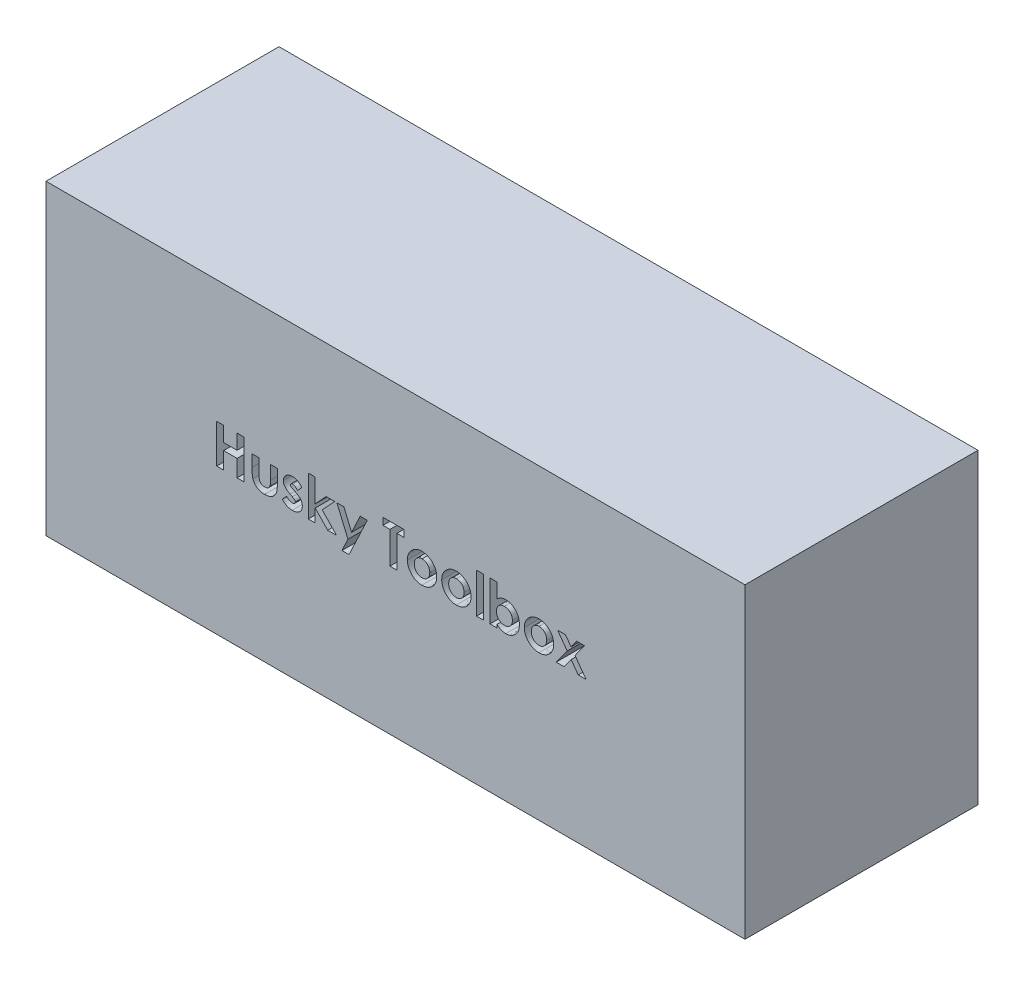
from build123d import *

# Parameters (mm, degrees)
SKETCH1_W           = 1828.8
SKETCH1_H           = 609.6
BOSS_EXTRUDE1_DEPTH = 803.275
SKETCH2_W           = 18.235897436
SKETCH2_H           = 104.205128205
CUT_EXTRUDE1_DEPTH  = 76.2


with BuildPart() as part:
    # Sketch1 → Boss-Extrude1 (new body)
    with BuildSketch(Plane(origin=(0, 0, 0), x_dir=(1, 0, 0), z_dir=(0, 1, 0))):
        Rectangle(SKETCH1_W, SKETCH1_H)
    extrude(amount=BOSS_EXTRUDE1_DEPTH)

    # Sketch2 → Cut-Extrude1 (cut)
    # profile 1 of 12: a face of its own
    with BuildSketch(Plane.XY.offset(304.8)):
        Polygon((-467.882093783, 482.6), (-449.646196347, 482.6), (-449.646196347, 443.523076923), (-414.476965577, 443.523076923), (-414.476965577, 482.6), (-396.241068142, 482.6), (-396.241068142, 381), (-414.476965577, 381), (-414.476965577, 425.287179487), (-449.646196347, 425.287179487), (-449.646196347, 381), (-467.882093783, 381), align=None)
    # profile 2 of 12: a face of its own
    with BuildSketch(Plane.XY.offset(304.8)):
        with BuildLine():
            Line((-375.4000425, 455.246153846), (-357.164145065, 455.246153846))
            Line((-357.164145065, 455.246153846), (-357.164145065, 419.608814103))
            add(Edge.make_bspline(
                [(-357.164145065, 419.608814103), (-357.162525707, 418.774273627), (-357.159417764, 417.172586653), (-357.072933887, 414.87225059), (-356.951579907, 412.768698591), (-356.800138351, 410.85945019), (-356.574102125, 409.149097763), (-356.313152828, 407.640906423), (-356.017320511, 406.324009467), (-355.536259804, 404.856152232), (-354.783631639, 403.249864802), (-353.64702989, 401.544602062), (-352.270273655, 400.070048407), (-350.671963842, 398.813117931), (-348.835777783, 397.822629117), (-346.787013305, 397.151389962), (-344.551448045, 396.700247459), (-342.994380186, 396.654539006), (-342.184657885, 396.630769231)],
                knots=[0, 0, 0, 0, 1.267339619, 2.432334223, 3.495366327, 4.467371443, 5.340232306, 6.114347373, 6.791623365, 7.387877112, 8.457231658, 9.474542289, 10.487879852, 11.508108106, 12.54995813, 13.638205937, 14.771795776, 16, 16, 16, 16], degree=3))
            add(Edge.make_bspline(
                [(-342.184657885, 396.630769231), (-341.375654139, 396.657899066), (-339.814559449, 396.710250174), (-337.564120106, 397.118498038), (-335.51052999, 397.818044352), (-333.632697412, 398.766896366), (-331.985999769, 400.036773171), (-330.552287479, 401.549921474), (-329.34513537, 403.330750214), (-328.765043116, 404.659197429), (-328.46702968, 405.341666667)],
                knots=[0, 0, 0, 0, 1.116871431, 2.155171802, 3.144773418, 4.104381479, 5.046960687, 6.001340237, 6.973219418, 8, 8, 8, 8], degree=3))
            add(Edge.make_bspline(
                [(-328.46702968, 405.341666667), (-328.357668762, 405.644825621), (-328.116267146, 406.314014055), (-327.901414931, 407.468456184), (-327.67016997, 408.82993376), (-327.487246993, 410.426192545), (-327.383742718, 412.247346757), (-327.272848484, 414.295691681), (-327.216334791, 416.569187285), (-327.20900602, 418.163760351), (-327.205170706, 418.998237179)],
                knots=[0, 0, 0, 0, 0.56094539, 1.238222264, 2.041156151, 2.969685991, 4.036367568, 5.220421584, 6.545382566, 8, 8, 8, 8], degree=3))
            Line((-327.205170706, 418.998237179), (-327.205170706, 455.246153846))
            Line((-327.205170706, 455.246153846), (-308.96927327, 455.246153846))
            Line((-308.96927327, 455.246153846), (-308.96927327, 424.045673077))
            add(Edge.make_bspline(
                [(-308.96927327, 424.045673077), (-308.972430797, 422.498687074), (-308.978484734, 419.532646688), (-309.15198684, 415.277958136), (-309.391439408, 411.409597034), (-309.699808249, 407.916912562), (-310.144129648, 404.798455232), (-310.689557842, 402.061537917), (-311.292975556, 399.68807469), (-311.846332096, 398.281781328), (-312.103568142, 397.628044872)],
                knots=[0, 0, 0, 0, 1.388070971, 2.661352173, 3.82033814, 4.865898334, 5.806910977, 6.645039373, 7.370126333, 8, 8, 8, 8], degree=3))
            add(Edge.make_bspline(
                [(-312.103568142, 397.628044872), (-312.433278496, 396.924422468), (-313.084098412, 395.535532291), (-314.213391943, 393.56083805), (-315.430833628, 391.689971702), (-316.794349805, 389.966971599), (-318.276106878, 388.374326219), (-319.834220235, 386.87583086), (-321.538859205, 385.532506509), (-323.345816208, 384.309785646), (-325.280304814, 383.224386644), (-327.32907519, 382.262539284), (-329.51426756, 381.479760465), (-331.816933713, 380.816245009), (-334.24768744, 380.321427404), (-336.801632258, 379.946640821), (-339.481569246, 379.752949687), (-341.309236633, 379.716243691), (-342.245715577, 379.697435897)],
                knots=[0, 0, 0, 0, 0.997311338, 1.968606903, 2.91805772, 3.860812155, 4.785445165, 5.709667791, 6.633356648, 7.568312411, 8.508286151, 9.478643871, 10.470653671, 11.485274776, 12.552984541, 13.653035246, 14.797438149, 16, 16, 16, 16], degree=3))
            add(Edge.make_bspline(
                [(-342.245715577, 379.697435897), (-343.257375993, 379.70949222), (-345.236852369, 379.733082355), (-348.1288397, 380.021969064), (-350.884942508, 380.395750909), (-353.474389074, 381.031248555), (-355.933342226, 381.767504367), (-358.233571792, 382.707162623), (-360.384477085, 383.811934489), (-362.390290303, 385.075270267), (-364.23545509, 386.508747089), (-365.961000745, 388.050401505), (-367.511219242, 389.761571057), (-368.936718905, 391.589414161), (-370.221590355, 393.550753346), (-371.366471323, 395.638614688), (-372.372331584, 397.862494834), (-372.909007929, 399.421117273), (-373.181613013, 400.212820513)],
                knots=[0, 0, 0, 0, 1.211240017, 2.369985978, 3.478996442, 4.539426614, 5.559871561, 6.551301256, 7.510778031, 8.453136967, 9.386094087, 10.30661716, 11.221130616, 12.147659962, 13.080758632, 14.026335491, 14.997475882, 16, 16, 16, 16], degree=3))
            add(Edge.make_bspline(
                [(-373.181613013, 400.212820513), (-373.36759309, 400.827687554), (-373.76823753, 402.152254499), (-374.200810772, 404.353530156), (-374.546798584, 406.890623605), (-374.883364586, 409.766030434), (-375.118159181, 412.984571264), (-375.271623716, 416.541134626), (-375.37531496, 420.442675371), (-375.391557156, 423.156872626), (-375.4000425, 424.574839744)],
                knots=[0, 0, 0, 0, 0.627914866, 1.352675004, 2.190563461, 3.132055958, 4.183353232, 5.345633452, 6.613289997, 8, 8, 8, 8], degree=3))
            Line((-375.4000425, 424.574839744), (-375.4000425, 455.246153846))
        make_face()
    # profile 3 of 12: a face of its own
    with BuildSketch(Plane.XY.offset(304.8)):
        with BuildLine():
            Line((-245.143632244, 443.787660256), (-256.296837372, 431.8))
            add(Edge.make_bspline(
                [(-256.296837372, 431.8), (-256.853770336, 432.416276519), (-257.918972125, 433.594980052), (-259.549693112, 435.201816403), (-261.156129489, 436.539836419), (-262.708345429, 437.663828997), (-264.238042727, 438.525796945), (-265.732506161, 439.145963578), (-267.192452775, 439.539654578), (-268.160167109, 439.590616389), (-268.630491218, 439.615384615)],
                knots=[0, 0, 0, 0, 1.327646587, 2.539285, 3.655602211, 4.666613517, 5.598770349, 6.454635452, 7.248928967, 8, 8, 8, 8], degree=3))
            add(Edge.make_bspline(
                [(-268.630491218, 439.615384615), (-269.106411975, 439.600880181), (-270.017652173, 439.5731087), (-271.303616285, 439.334899061), (-272.433421786, 438.922514268), (-273.389437341, 438.360395366), (-274.157517158, 437.667922611), (-274.695285658, 436.875750115), (-275.05640215, 436.00851631), (-275.086950267, 435.392486633), (-275.102606603, 435.076762821)],
                knots=[0, 0, 0, 0, 1.295068245, 2.479652818, 3.543291146, 4.55379989, 5.481948265, 6.332409746, 7.145336708, 8, 8, 8, 8], degree=3))
            add(Edge.make_bspline(
                [(-275.102606603, 435.076762821), (-275.049561499, 434.598304786), (-274.93949907, 433.605559946), (-274.183522822, 432.454124043), (-273.183311652, 431.604733351), (-272.030357382, 430.814326538), (-270.468958823, 429.93056709), (-269.284442242, 429.325431177), (-268.630491218, 428.991346154)],
                knots=[0, 0, 0, 0, 0.916701701, 1.902049539, 2.5493345, 3.440293453, 4.586830489, 6, 6, 6, 6], degree=3))
            Line((-268.630491218, 428.991346154), (-262.036260449, 425.653525641))
            add(Edge.make_bspline(
                [(-262.036260449, 425.653525641), (-261.197348212, 425.227553258), (-259.569700886, 424.401086817), (-257.281381225, 423.067472235), (-255.167852702, 421.774837207), (-253.271512085, 420.450060905), (-251.580752549, 419.116159118), (-250.107583478, 417.759941323), (-248.816273099, 416.424402184), (-247.376280767, 414.633809319), (-245.935856254, 412.248885313), (-244.734989576, 409.147402778), (-243.969211496, 405.826396923), (-243.884486973, 403.527802134), (-243.841068142, 402.349839744)],
                knots=[0, 0, 0, 0, 1.076693506, 2.088987655, 3.030641824, 3.911722491, 4.735175175, 5.493635918, 6.202154166, 6.859459289, 8.120623445, 9.372284821, 10.653373066, 12, 12, 12, 12], degree=3))
            add(Edge.make_bspline(
                [(-243.841068142, 402.349839744), (-243.867228266, 401.555136226), (-243.918430573, 399.999690543), (-244.242120756, 397.710222788), (-244.823552148, 395.533277934), (-245.58871498, 393.43492175), (-246.619366384, 391.453098916), (-247.870627691, 389.578202241), (-249.322741015, 387.785615357), (-251.014095068, 386.13665914), (-252.866945146, 384.599849995), (-254.926700686, 383.307283145), (-257.102288259, 382.170819803), (-259.451183442, 381.283343121), (-261.940428313, 380.563835327), (-264.591360841, 380.065234453), (-267.394985863, 379.751452147), (-269.314823558, 379.715747053), (-270.299401475, 379.697435897)],
                knots=[0, 0, 0, 0, 0.976600749, 1.911466839, 2.833459288, 3.740827163, 4.650527853, 5.570709661, 6.506801416, 7.479409329, 8.468875524, 9.458587492, 10.461481786, 11.480119772, 12.538142914, 13.641687514, 14.790552763, 16, 16, 16, 16], degree=3))
            add(Edge.make_bspline(
                [(-270.299401475, 379.697435897), (-271.603882656, 379.738976375), (-274.164464364, 379.820516675), (-277.904008573, 380.388514764), (-281.435131077, 381.371729021), (-284.760737027, 382.749086426), (-287.901195281, 384.504217347), (-290.811656578, 386.681950612), (-293.542576417, 389.225547087), (-295.131453952, 391.176367126), (-295.943632244, 392.173557692)],
                knots=[0, 0, 0, 0, 1.056901255, 2.07460411, 3.05625841, 4.019970729, 4.984811261, 5.963335951, 6.958928997, 8, 8, 8, 8], degree=3))
            Line((-295.943632244, 392.173557692), (-284.892189936, 404.446153846))
            add(Edge.make_bspline(
                [(-284.892189936, 404.446153846), (-284.353726347, 403.878213229), (-283.284700015, 402.750665357), (-281.482753611, 401.263841039), (-279.576166696, 399.908710061), (-277.5437144, 398.770842188), (-275.510851422, 397.852065081), (-273.560487115, 397.162853726), (-271.729378261, 396.729730923), (-270.538838488, 396.66262188), (-269.973760449, 396.630769231)],
                knots=[0, 0, 0, 0, 1.087861918, 2.159761696, 3.243809206, 4.338405912, 5.394481878, 6.343674753, 7.213841449, 8, 8, 8, 8], degree=3))
            add(Edge.make_bspline(
                [(-269.973760449, 396.630769231), (-269.40898828, 396.647125411), (-268.323340299, 396.678566503), (-266.780353407, 397.00561557), (-265.412733021, 397.555433368), (-264.252940016, 398.317769693), (-263.288255228, 399.192815372), (-262.608529452, 400.187309916), (-262.159058782, 401.241852654), (-262.104430886, 401.979148801), (-262.076965577, 402.349839744)],
                knots=[0, 0, 0, 0, 1.255011871, 2.412479185, 3.488767498, 4.514443302, 5.48617286, 6.365347346, 7.178144445, 8, 8, 8, 8], degree=3))
            add(Edge.make_bspline(
                [(-262.076965577, 402.349839744), (-262.101472778, 402.698923307), (-262.151790785, 403.415659155), (-262.550160059, 404.47361255), (-263.175607662, 405.521156162), (-264.043069359, 406.561243496), (-265.164087837, 407.585435475), (-266.53465125, 408.585528661), (-268.123140659, 409.614879252), (-269.296489352, 410.229263714), (-269.912702757, 410.551923077)],
                knots=[0, 0, 0, 0, 0.704666567, 1.446816302, 2.258757648, 3.165368109, 4.175243826, 5.322435858, 6.59381024, 8, 8, 8, 8], degree=3))
            Line((-269.912702757, 410.551923077), (-275.957414295, 413.604807692))
            add(Edge.make_bspline(
                [(-275.957414295, 413.604807692), (-277.328596176, 414.340090271), (-279.960751283, 415.751557138), (-283.518441033, 418.171922857), (-286.529511798, 420.748450339), (-288.996417356, 423.467297589), (-290.962052588, 426.320834874), (-292.333215041, 429.345393303), (-293.195801466, 432.512299382), (-293.290699776, 434.677864116), (-293.338504039, 435.76875)],
                knots=[0, 0, 0, 0, 1.255999728, 2.41104856, 3.467751088, 4.449286722, 5.368722015, 6.253902015, 7.120417131, 8, 8, 8, 8], degree=3))
            add(Edge.make_bspline(
                [(-293.338504039, 435.76875), (-293.321925919, 436.475759698), (-293.289380376, 437.863734605), (-292.942913518, 439.902071943), (-292.419476444, 441.861432308), (-291.680850346, 443.744927337), (-290.734683212, 445.554425956), (-289.575464323, 447.281897766), (-288.189051315, 448.924202203), (-286.619829108, 450.476049044), (-284.878727813, 451.889382777), (-283.015493357, 453.141926959), (-281.035636838, 454.208861693), (-278.922909841, 455.059497958), (-276.704166261, 455.736551484), (-274.364760039, 456.196764176), (-271.914672148, 456.489461057), (-270.239202779, 456.528685779), (-269.38353609, 456.548717949)],
                knots=[0, 0, 0, 0, 0.959035663, 1.882742823, 2.798841253, 3.708806893, 4.623422363, 5.566085165, 6.527241613, 7.536786942, 8.55815439, 9.567237405, 10.580975912, 11.605536372, 12.654523293, 13.725718749, 14.838518481, 16, 16, 16, 16], degree=3))
            add(Edge.make_bspline(
                [(-269.38353609, 456.548717949), (-268.200571367, 456.50976987), (-265.852595058, 456.432464805), (-262.389791794, 455.806911748), (-259.045083027, 454.755501446), (-255.827845541, 453.306833878), (-252.779463052, 451.486270451), (-249.966970971, 449.275491579), (-247.371335322, 446.72893666), (-245.893573786, 444.77782155), (-245.143632244, 443.787660256)],
                knots=[0, 0, 0, 0, 0.996590028, 1.978055413, 2.954661574, 3.945146934, 4.945404762, 5.939399542, 6.954276554, 8, 8, 8, 8], degree=3))
        make_face()
    # profile 4 of 12: a face of its own
    with BuildSketch(Plane.XY.offset(304.8)):
        Polygon((-228.210298911, 485.205128205), (-209.974401475, 485.205128205), (-209.974401475, 424.432371795), (-181.602927116, 455.246153846), (-159.072638654, 455.246153846), (-191.657093783, 419.853044872), (-154.411901475, 381), (-177.369593783, 381), (-209.974401475, 415.009134615), (-209.974401475, 381), (-228.210298911, 381), align=None)
    # profile 5 of 12: a face of its own
    with BuildSketch(Plane.XY.offset(304.8)):
        Polygon((-153.353568142, 455.246153846), (-135.097318142, 455.246153846), (-114.826164295, 407.478685897), (-92.397638654, 455.246153846), (-73.856452757, 455.246153846), (-121.583215577, 353.646153846), (-140.124401475, 353.646153846), (-124.432574552, 387.044711538), align=None)
    # profile 6 of 12: a face of its own
    with BuildSketch(Plane.XY.offset(304.8)):
        Polygon((-32.825683526, 482.6), (21.882008782, 482.6), (21.882008782, 464.364102564), (3.646111346, 464.364102564), (3.646111346, 381), (-14.58978609, 381), (-14.58978609, 464.364102564), (-32.825683526, 464.364102564), align=None)
    # profile 7 of 12: a face of its own
    with BuildSketch(Plane.XY.offset(304.8)):
        with BuildLine():
            add(Edge.make_bspline(
                [(68.977842115, 456.548717949), (69.840000141, 456.533375257), (71.547463696, 456.502989774), (74.090517354, 456.250058382), (76.589112574, 455.837390386), (79.057610941, 455.303057365), (81.473090149, 454.554376883), (83.848219087, 453.656450411), (86.204234427, 452.625525813), (88.48266034, 451.398364947), (90.69995675, 450.067397071), (92.802085706, 448.599230298), (94.771590478, 447.005396577), (96.645031775, 445.3228502), (98.335104212, 443.478338586), (99.949812485, 441.560738038), (101.401917838, 439.501347624), (102.746358221, 437.350349924), (103.943303824, 435.120183735), (104.982630949, 432.82636289), (105.884669177, 430.500601083), (106.590947033, 428.114568946), (107.175679998, 425.699729478), (107.544688059, 423.226490632), (107.807027205, 420.720258779), (107.836443738, 419.032857257), (107.851239551, 418.184134615)],
                knots=[0, 0, 0, 0, 1.022364134, 2.024744242, 3.027414945, 4.024939316, 5.017584196, 6.023349371, 7.035562955, 8.064994934, 9.090267829, 10.101425541, 11.102933353, 12.093946398, 13.084502048, 14.067315274, 15.065326281, 16.070028806, 17.074376865, 18.064572984, 19.055292013, 20.030201733, 21.013838017, 21.999348303, 22.993720005, 24, 24, 24, 24], degree=3))
            add(Edge.make_bspline(
                [(107.851239551, 418.184134615), (107.835625021, 417.328781327), (107.804579797, 415.628145087), (107.554179165, 413.098339026), (107.13993161, 410.61346969), (106.603547795, 408.158898289), (105.857669087, 405.766033403), (104.98618943, 403.39960327), (103.916413869, 401.091863213), (102.73369816, 398.817637962), (101.380613592, 396.643851025), (99.9297652, 394.563830488), (98.321820121, 392.632145062), (96.645277183, 390.788887806), (94.82061416, 389.096389433), (92.876956084, 387.527168278), (90.831129636, 386.062039917), (88.668423164, 384.735379018), (86.416537323, 383.569689396), (84.113449752, 382.518725075), (81.745693275, 381.643722235), (79.318168085, 380.930181514), (76.829401978, 380.377704796), (74.284889503, 380.002400789), (71.690110595, 379.741381179), (69.941850741, 379.712178628), (69.059252371, 379.697435897)],
                knots=[0, 0, 0, 0, 1.012026251, 2.012137606, 3.004615893, 3.992048833, 4.982446996, 5.968083444, 6.973977695, 7.990229942, 8.999482246, 10.001782172, 10.988562221, 11.971415814, 12.948383116, 13.930088534, 14.925840678, 15.924049238, 16.929462851, 17.924729459, 18.917889337, 19.913673841, 20.916777188, 21.931792057, 22.95587778, 24, 24, 24, 24], degree=3))
            add(Edge.make_bspline(
                [(69.059252371, 379.697435897), (67.768713581, 379.735315756), (65.225041976, 379.809977533), (61.478815086, 380.321391176), (57.879927697, 381.201668138), (54.422515465, 382.428754813), (51.102087124, 384.001220663), (47.94762072, 385.947385939), (44.927737906, 388.228936226), (42.094745334, 390.826587663), (39.499340354, 393.676446514), (37.231941841, 396.718653475), (35.306737014, 399.907610972), (33.725457977, 403.246955497), (32.505033013, 406.741266188), (31.623677958, 410.380096281), (31.111639055, 414.173673997), (31.037608739, 416.751140129), (30.9999575, 418.062019231)],
                knots=[0, 0, 0, 0, 1.029999031, 2.030143771, 3.011211297, 3.982305373, 4.953580601, 5.938004764, 6.935448627, 7.970290061, 9.001484052, 10.007591832, 10.993831261, 11.969999897, 12.951306496, 13.942897864, 14.953773953, 16, 16, 16, 16], degree=3))
            add(Edge.make_bspline(
                [(30.9999575, 418.062019231), (31.03892175, 419.461750752), (31.115505205, 422.212895032), (31.723611537, 426.243384096), (32.694691747, 430.102386361), (34.088616221, 433.779106977), (35.869232138, 437.280327155), (38.04296063, 440.598662438), (40.620544399, 443.734864464), (42.594457423, 445.631746965), (43.598194679, 446.596314103)],
                knots=[0, 0, 0, 0, 1.043912699, 2.05178951, 3.033892, 4.007821512, 4.978932272, 5.95884105, 6.962068106, 8, 8, 8, 8], degree=3))
            add(Edge.make_bspline(
                [(43.598194679, 446.596314103), (44.519223944, 447.395831764), (46.336224017, 448.9731146), (49.288251119, 450.973639295), (52.310793761, 452.701482303), (55.440078416, 454.122090618), (58.684828725, 455.19320637), (62.028417183, 455.972882802), (65.470148537, 456.451782915), (67.80266903, 456.516242067), (68.977842115, 456.548717949)],
                knots=[0, 0, 0, 0, 1.048115528, 2.067714963, 3.060638214, 4.039924844, 5.017819947, 5.994373833, 6.98952318, 8, 8, 8, 8], degree=3))
        make_face()
        with BuildLine():
            add(Edge.make_bspline(
                [(69.384893397, 439.615384615), (68.678849491, 439.591918054), (67.288994463, 439.545723877), (65.243091346, 439.297812062), (63.308054632, 438.789695509), (61.445450887, 438.143510317), (59.688229752, 437.279328666), (57.988267202, 436.268036986), (56.433957546, 435.002529892), (54.950082774, 433.614361192), (53.603055236, 432.072837104), (52.455259862, 430.393347765), (51.429679269, 428.640146915), (50.652033512, 426.749047687), (50.008457309, 424.771739312), (49.572892651, 422.676274499), (49.269770064, 420.486060735), (49.247267507, 418.985749292), (49.235854935, 418.224839744)],
                knots=[0, 0, 0, 0, 1.030650113, 2.02884584, 2.99876339, 3.944280128, 4.900564847, 5.851248946, 6.823638398, 7.81794922, 8.81432732, 9.802856497, 10.78262424, 11.771747962, 12.779760563, 13.812642396, 14.89064281, 16, 16, 16, 16], degree=3))
            add(Edge.make_bspline(
                [(49.235854935, 418.224839744), (49.249209195, 417.437096695), (49.275307531, 415.897604184), (49.545561268, 413.649738096), (49.991218586, 411.516528077), (50.624357969, 409.501269478), (51.420637648, 407.589497019), (52.397580475, 405.791937037), (53.565496987, 404.119397562), (54.889630843, 402.573938209), (56.33950086, 401.17110765), (57.928155079, 399.967250956), (59.58906664, 398.921259268), (61.360511957, 398.081166498), (63.217331436, 397.432546721), (65.165037205, 396.954989795), (67.213864456, 396.697705274), (68.61084085, 396.653388048), (69.323835705, 396.630769231)],
                knots=[0, 0, 0, 0, 1.141730614, 2.231293227, 3.276944405, 4.297399982, 5.28939179, 6.275415646, 7.257752684, 8.24146775, 9.222424823, 10.176631434, 11.126518621, 12.063689483, 13.012557477, 13.974037417, 14.965980454, 16, 16, 16, 16], degree=3))
            add(Edge.make_bspline(
                [(69.323835705, 396.630769231), (70.037187163, 396.6508311), (71.435770134, 396.690164011), (73.487003349, 396.984705395), (75.444655534, 397.448255479), (77.317333704, 398.102457704), (79.089897081, 398.960532209), (80.769131195, 400.01152806), (82.36980848, 401.232129318), (83.839135895, 402.661428624), (85.199264181, 404.211707711), (86.392015338, 405.893076403), (87.388723187, 407.690636847), (88.206202096, 409.593078771), (88.840582649, 411.59778729), (89.278862023, 413.71221365), (89.582146674, 415.929805087), (89.604140313, 417.450380281), (89.615342115, 418.224839744)],
                knots=[0, 0, 0, 0, 1.031504075, 2.022346795, 2.991027682, 3.937587355, 4.885570121, 5.833146507, 6.798790848, 7.791235734, 8.792807298, 9.778388351, 10.766749885, 11.760164525, 12.768777521, 13.802286646, 14.880660483, 16, 16, 16, 16], degree=3))
            add(Edge.make_bspline(
                [(89.615342115, 418.224839744), (89.601817972, 418.999028529), (89.575279218, 420.518238071), (89.305006223, 422.738828767), (88.86372246, 424.84642071), (88.222416974, 426.832014655), (87.430870269, 428.718263084), (86.453252185, 430.495510994), (85.279575879, 432.155004985), (83.949005037, 433.688516366), (82.477400562, 435.071662023), (80.916329213, 436.305092181), (79.230094087, 437.325233682), (77.45032997, 438.166194442), (75.572301757, 438.813193701), (73.598117847, 439.29345707), (71.521727977, 439.547080541), (70.104615755, 439.592378637), (69.384893397, 439.615384615)],
                knots=[0, 0, 0, 0, 1.123894411, 2.205445421, 3.243160173, 4.246488011, 5.231014757, 6.210004299, 7.185865357, 8.177612767, 9.153374344, 10.115157457, 11.061423229, 12.009021698, 12.96873347, 13.94135618, 14.954456845, 16, 16, 16, 16], degree=3))
        make_face(mode=Mode.SUBTRACT)
    # profile 8 of 12: a face of its own
    with BuildSketch(Plane.XY.offset(304.8)):
        with BuildLine():
            add(Edge.make_bspline(
                [(158.854765192, 456.548717949), (159.716923218, 456.533375257), (161.424386772, 456.502989774), (163.967440431, 456.250058382), (166.466035651, 455.837390386), (168.934534018, 455.303057365), (171.350013226, 454.554376883), (173.725142164, 453.656450411), (176.081157504, 452.625525813), (178.359583417, 451.398364947), (180.576879827, 450.067397071), (182.679008783, 448.599230298), (184.648513555, 447.005396577), (186.521954852, 445.3228502), (188.212027289, 443.478338586), (189.826735562, 441.560738038), (191.278840915, 439.501347624), (192.623281298, 437.350349924), (193.820226901, 435.120183735), (194.859554026, 432.82636289), (195.761592253, 430.500601083), (196.467870109, 428.114568946), (197.052603075, 425.699729478), (197.421611136, 423.226490632), (197.683950282, 420.720258779), (197.713366815, 419.032857257), (197.728162628, 418.184134615)],
                knots=[0, 0, 0, 0, 1.022364134, 2.024744242, 3.027414945, 4.024939316, 5.017584196, 6.023349371, 7.035562955, 8.064994934, 9.090267829, 10.101425541, 11.102933353, 12.093946398, 13.084502048, 14.067315274, 15.065326281, 16.070028806, 17.074376865, 18.064572984, 19.055292013, 20.030201733, 21.013838017, 21.999348303, 22.993720005, 24, 24, 24, 24], degree=3))
            add(Edge.make_bspline(
                [(197.728162628, 418.184134615), (197.712548098, 417.328781327), (197.681502874, 415.628145087), (197.431102242, 413.098339026), (197.016854687, 410.61346969), (196.480470872, 408.158898289), (195.734592164, 405.766033403), (194.863112507, 403.39960327), (193.793336946, 401.091863213), (192.610621237, 398.817637962), (191.257536669, 396.643851025), (189.806688277, 394.563830488), (188.198743198, 392.632145062), (186.52220026, 390.788887806), (184.697537237, 389.096389433), (182.753879161, 387.527168278), (180.708052713, 386.062039917), (178.545346241, 384.735379018), (176.293460399, 383.569689396), (173.990372829, 382.518725075), (171.622616352, 381.643722235), (169.195091162, 380.930181514), (166.706325055, 380.377704796), (164.16181258, 380.002400789), (161.567033672, 379.741381179), (159.818773818, 379.712178628), (158.936175448, 379.697435897)],
                knots=[0, 0, 0, 0, 1.012026251, 2.012137606, 3.004615893, 3.992048833, 4.982446996, 5.968083444, 6.973977695, 7.990229942, 8.999482246, 10.001782172, 10.988562221, 11.971415814, 12.948383116, 13.930088534, 14.925840678, 15.924049238, 16.929462851, 17.924729459, 18.917889337, 19.913673841, 20.916777188, 21.931792057, 22.95587778, 24, 24, 24, 24], degree=3))
            add(Edge.make_bspline(
                [(158.936175448, 379.697435897), (157.645636658, 379.735315756), (155.101965053, 379.809977533), (151.355738163, 380.321391176), (147.756850774, 381.201668138), (144.299438542, 382.428754813), (140.979010201, 384.001220663), (137.824543797, 385.947385939), (134.804660983, 388.228936226), (131.971668411, 390.826587663), (129.376263431, 393.676446514), (127.108864918, 396.718653475), (125.183660091, 399.907610972), (123.602381054, 403.246955497), (122.38195609, 406.741266188), (121.500601035, 410.380096281), (120.988562132, 414.173673997), (120.914531816, 416.751140129), (120.876880576, 418.062019231)],
                knots=[0, 0, 0, 0, 1.029999031, 2.030143771, 3.011211297, 3.982305373, 4.953580601, 5.938004764, 6.935448627, 7.970290061, 9.001484052, 10.007591832, 10.993831261, 11.969999897, 12.951306496, 13.942897864, 14.953773953, 16, 16, 16, 16], degree=3))
            add(Edge.make_bspline(
                [(120.876880576, 418.062019231), (120.915844827, 419.461750752), (120.992428282, 422.212895032), (121.600534614, 426.243384096), (122.571614823, 430.102386361), (123.965539298, 433.779106977), (125.746155215, 437.280327155), (127.919883707, 440.598662438), (130.497467476, 443.734864464), (132.4713805, 445.631746965), (133.475117756, 446.596314103)],
                knots=[0, 0, 0, 0, 1.043912699, 2.05178951, 3.033892, 4.007821512, 4.978932272, 5.95884105, 6.962068106, 8, 8, 8, 8], degree=3))
            add(Edge.make_bspline(
                [(133.475117756, 446.596314103), (134.39614702, 447.395831764), (136.213147094, 448.9731146), (139.165174196, 450.973639295), (142.187716837, 452.701482303), (145.317001493, 454.122090618), (148.561751802, 455.19320637), (151.90534026, 455.972882802), (155.347071614, 456.451782915), (157.679592107, 456.516242067), (158.854765192, 456.548717949)],
                knots=[0, 0, 0, 0, 1.048115528, 2.067714963, 3.060638214, 4.039924844, 5.017819947, 5.994373833, 6.98952318, 8, 8, 8, 8], degree=3))
        make_face()
        with BuildLine():
            add(Edge.make_bspline(
                [(159.261816474, 439.615384615), (158.555772568, 439.591918054), (157.16591754, 439.545723877), (155.120014423, 439.297812062), (153.184977709, 438.789695509), (151.322373964, 438.143510317), (149.565152829, 437.279328666), (147.865190278, 436.268036986), (146.310880623, 435.002529892), (144.827005851, 433.614361192), (143.479978313, 432.072837104), (142.332182938, 430.393347765), (141.306602346, 428.640146915), (140.528956589, 426.749047687), (139.885380385, 424.771739312), (139.449815728, 422.676274499), (139.146693141, 420.486060735), (139.124190583, 418.985749292), (139.112778012, 418.224839744)],
                knots=[0, 0, 0, 0, 1.030650113, 2.02884584, 2.99876339, 3.944280128, 4.900564847, 5.851248946, 6.823638398, 7.81794922, 8.81432732, 9.802856497, 10.78262424, 11.771747962, 12.779760563, 13.812642396, 14.89064281, 16, 16, 16, 16], degree=3))
            add(Edge.make_bspline(
                [(139.112778012, 418.224839744), (139.126132272, 417.437096695), (139.152230608, 415.897604184), (139.422484345, 413.649738096), (139.868141663, 411.516528077), (140.501281046, 409.501269478), (141.297560725, 407.589497019), (142.274503552, 405.791937037), (143.442420064, 404.119397562), (144.76655392, 402.573938209), (146.216423937, 401.17110765), (147.805078156, 399.967250956), (149.465989717, 398.921259268), (151.237435034, 398.081166498), (153.094254513, 397.432546721), (155.041960282, 396.954989795), (157.090787533, 396.697705274), (158.487763927, 396.653388048), (159.200758782, 396.630769231)],
                knots=[0, 0, 0, 0, 1.141730614, 2.231293227, 3.276944405, 4.297399982, 5.28939179, 6.275415646, 7.257752684, 8.24146775, 9.222424823, 10.176631434, 11.126518621, 12.063689483, 13.012557477, 13.974037417, 14.965980454, 16, 16, 16, 16], degree=3))
            add(Edge.make_bspline(
                [(159.200758782, 396.630769231), (159.91411024, 396.6508311), (161.312693211, 396.690164011), (163.363926426, 396.984705395), (165.321578611, 397.448255479), (167.19425678, 398.102457704), (168.966820157, 398.960532209), (170.646054272, 400.01152806), (172.246731557, 401.232129318), (173.716058972, 402.661428624), (175.076187258, 404.211707711), (176.268938415, 405.893076403), (177.265646264, 407.690636847), (178.083125173, 409.593078771), (178.717505726, 411.59778729), (179.1557851, 413.71221365), (179.459069751, 415.929805087), (179.48106339, 417.450380281), (179.492265192, 418.224839744)],
                knots=[0, 0, 0, 0, 1.031504075, 2.022346795, 2.991027682, 3.937587355, 4.885570121, 5.833146507, 6.798790848, 7.791235734, 8.792807298, 9.778388351, 10.766749885, 11.760164525, 12.768777521, 13.802286646, 14.880660483, 16, 16, 16, 16], degree=3))
            add(Edge.make_bspline(
                [(179.492265192, 418.224839744), (179.478741049, 418.999028529), (179.452202295, 420.518238071), (179.1819293, 422.738828767), (178.740645537, 424.84642071), (178.099340051, 426.832014655), (177.307793346, 428.718263084), (176.330175262, 430.495510994), (175.156498956, 432.155004985), (173.825928114, 433.688516366), (172.354323639, 435.071662023), (170.79325229, 436.305092181), (169.107017164, 437.325233682), (167.327253047, 438.166194442), (165.449224834, 438.813193701), (163.475040924, 439.29345707), (161.398651054, 439.547080541), (159.981538832, 439.592378637), (159.261816474, 439.615384615)],
                knots=[0, 0, 0, 0, 1.123894411, 2.205445421, 3.243160173, 4.246488011, 5.231014757, 6.210004299, 7.185865357, 8.177612767, 9.153374344, 10.115157457, 11.061423229, 12.009021698, 12.96873347, 13.94135618, 14.954456845, 16, 16, 16, 16], degree=3))
        make_face(mode=Mode.SUBTRACT)
    # profile 9 of 12: a face of its own
    with BuildSketch(Plane.XY.offset(304.8)):
        with Locations((221.174316474, 433.102564103)):
            Rectangle(SKETCH2_W, SKETCH2_H)
    # profile 10 of 12: a face of its own
    with BuildSketch(Plane.XY.offset(304.8)):
        with BuildLine():
            Line((265.461495961, 485.205128205), (265.461495961, 446.596314103))
            add(Edge.make_bspline(
                [(265.461495961, 446.596314103), (266.308287636, 447.393619503), (267.970584783, 448.958772457), (270.684649457, 450.982686535), (273.49609719, 452.69085343), (276.402409352, 454.123925542), (279.429743014, 455.183620577), (282.5409019, 456.00704332), (285.767765173, 456.443145363), (287.949956439, 456.513332696), (289.050117756, 456.548717949)],
                knots=[0, 0, 0, 0, 1.061187343, 2.083167259, 3.083809127, 4.061667593, 5.035358583, 6.007314429, 6.995378812, 8, 8, 8, 8], degree=3))
            add(Edge.make_bspline(
                [(289.050117756, 456.548717949), (290.246008021, 456.520073362), (292.601523804, 456.46365282), (296.06721709, 455.936886015), (299.38845833, 455.08540372), (302.577912278, 453.896502365), (305.618585884, 452.352912515), (308.544643288, 450.504755117), (311.305621184, 448.275765059), (313.902861775, 445.751060077), (316.305374021, 442.983795872), (318.395117222, 439.975192363), (320.135792208, 436.764848551), (321.611099784, 433.390717398), (322.687838513, 429.796840068), (323.517698883, 426.031426015), (323.980143652, 422.062619028), (324.044216965, 419.358916074), (324.076880576, 417.980608974)],
                knots=[0, 0, 0, 0, 0.985987466, 1.942075377, 2.884088208, 3.810275091, 4.743821533, 5.692411115, 6.659945104, 7.665215984, 8.677116751, 9.678438675, 10.680260931, 11.685531812, 12.710472044, 13.769734641, 14.863044265, 16, 16, 16, 16], degree=3))
            add(Edge.make_bspline(
                [(324.076880576, 417.980608974), (324.045966645, 416.649484999), (323.985028469, 414.025546149), (323.492686434, 410.173388), (322.65820791, 406.49348495), (321.487603657, 402.984511715), (319.999450274, 399.63537933), (318.183056351, 396.448395538), (316.027826478, 393.434692393), (313.563842559, 390.634867528), (310.871582064, 388.099417976), (308.066439603, 385.824615631), (305.092545967, 383.960593498), (302.024241848, 382.386284), (298.813189824, 381.182439994), (295.481322794, 380.339011961), (292.033917623, 379.775127997), (289.690101998, 379.723591198), (288.500598525, 379.697435897)],
                knots=[0, 0, 0, 0, 1.098553145, 2.165490463, 3.199345634, 4.208780719, 5.21409072, 6.219899742, 7.23156933, 8.267303578, 9.293302409, 10.281606823, 11.243293419, 12.184993323, 13.124258899, 14.066907486, 15.018941492, 16, 16, 16, 16], degree=3))
            add(Edge.make_bspline(
                [(288.500598525, 379.697435897), (287.441018429, 379.725761272), (285.354628183, 379.781535992), (282.279202126, 380.195204228), (279.323829347, 380.890914495), (276.451176455, 381.849259879), (273.653449012, 383.158641437), (270.881924539, 384.795851788), (268.118766099, 386.781605413), (266.365082693, 388.311857131), (265.461495961, 389.100320513)],
                knots=[0, 0, 0, 0, 0.996418773, 1.962021009, 2.912343664, 3.848616743, 4.805003894, 5.811808768, 6.872532775, 8, 8, 8, 8], degree=3))
            Line((265.461495961, 389.100320513), (265.461495961, 381))
            Line((265.461495961, 381), (247.225598525, 381))
            Line((247.225598525, 381), (247.225598525, 485.205128205))
            Line((247.225598525, 485.205128205), (265.461495961, 485.205128205))
        make_face()
        with BuildLine():
            add(Edge.make_bspline(
                [(285.10172032, 439.615384615), (284.361653199, 439.592627043), (282.910719326, 439.548009828), (280.780484138, 439.29230877), (278.762048789, 438.811205364), (276.82472461, 438.187646085), (274.993043694, 437.345939001), (273.252020813, 436.325616987), (271.616568002, 435.108960875), (270.078197292, 433.744148741), (268.695848904, 432.208732524), (267.467752276, 430.568060661), (266.44888253, 428.80076851), (265.59954355, 426.929265132), (264.958754397, 424.933301045), (264.483474493, 422.829855956), (264.225189992, 420.612483736), (264.181367218, 419.100614188), (264.158931858, 418.326602564)],
                knots=[0, 0, 0, 0, 1.060469436, 2.079096586, 3.066888298, 4.028858836, 4.99004353, 5.948472697, 6.914558426, 7.905691313, 8.889602648, 9.869280844, 10.836099585, 11.806137001, 12.808075328, 13.83377171, 14.890985086, 16, 16, 16, 16], degree=3))
            add(Edge.make_bspline(
                [(264.158931858, 418.326602564), (264.181649522, 417.539045104), (264.226233915, 415.99342968), (264.482365283, 413.728774969), (264.954309205, 411.583188157), (265.608594584, 409.55180465), (266.44348092, 407.634360888), (267.461143499, 405.82374863), (268.702758292, 404.159664613), (270.06992107, 402.583766096), (271.617803908, 401.200692484), (273.245888968, 399.960265711), (274.992620715, 398.938422789), (276.833055299, 398.110488488), (278.753227663, 397.422479617), (280.781752037, 396.957592734), (282.91038289, 396.697149582), (284.361539559, 396.653190907), (285.10172032, 396.630769231)],
                knots=[0, 0, 0, 0, 1.117193555, 2.192540452, 3.22680955, 4.227918444, 5.21468246, 6.188555072, 7.166222992, 8.154674427, 9.142376254, 10.104580718, 11.053462639, 12.005072638, 12.963662044, 13.941614018, 14.950094269, 16, 16, 16, 16], degree=3))
            add(Edge.make_bspline(
                [(285.10172032, 396.630769231), (285.814977235, 396.651598284), (287.226816783, 396.692827862), (289.292577226, 396.98051337), (291.278287664, 397.450620089), (293.168397365, 398.120692222), (294.974412167, 398.993125456), (296.712773504, 400.014016741), (298.32346661, 401.289544183), (299.869681661, 402.691457735), (301.253131046, 404.272413023), (302.494251408, 405.951969792), (303.536829395, 407.745118426), (304.364611746, 409.657805272), (305.048963015, 411.653801262), (305.516191217, 413.769640023), (305.773251611, 415.986436185), (305.818181661, 417.498294381), (305.840983141, 418.265544872)],
                knots=[0, 0, 0, 0, 1.021711385, 2.02240246, 2.981887075, 3.941027022, 4.888772411, 5.852236371, 6.822344989, 7.82661704, 8.838806642, 9.826383926, 10.814965113, 11.80282933, 12.807900643, 13.833672313, 14.900613836, 16, 16, 16, 16], degree=3))
            add(Edge.make_bspline(
                [(305.840983141, 418.265544872), (305.817817532, 419.025892693), (305.772174796, 420.523990781), (305.520378453, 422.722326965), (305.035161257, 424.807405071), (304.422512782, 426.79625867), (303.566587948, 428.662998059), (302.554543131, 430.429706476), (301.3636849, 432.10171837), (299.982238045, 433.633897593), (298.467034328, 435.028070615), (296.849580163, 436.261228152), (295.136227447, 437.310996569), (293.30364406, 438.13885787), (291.395076086, 438.820009309), (289.381356627, 439.289195422), (287.272723232, 439.548869266), (285.835107448, 439.592915046), (285.10172032, 439.615384615)],
                knots=[0, 0, 0, 0, 1.094680664, 2.156827393, 3.177782763, 4.17210342, 5.146667393, 6.126451192, 7.099203661, 8.094961544, 9.09004898, 10.058676268, 11.018205477, 11.974998356, 12.947750825, 13.930643515, 14.944335875, 16, 16, 16, 16], degree=3))
        make_face(mode=Mode.SUBTRACT)
    # profile 11 of 12: a face of its own
    with BuildSketch(Plane.XY.offset(304.8)):
        with BuildLine():
            add(Edge.make_bspline(
                [(375.080406217, 456.548717949), (375.942564244, 456.533375257), (377.650027798, 456.502989774), (380.193081457, 456.250058382), (382.691676677, 455.837390386), (385.160175044, 455.303057365), (387.575654251, 454.554376883), (389.950783189, 453.656450411), (392.30679853, 452.625525813), (394.585224443, 451.398364947), (396.802520853, 450.067397071), (398.904649809, 448.599230298), (400.87415458, 447.005396577), (402.747595878, 445.3228502), (404.437668314, 443.478338586), (406.052376587, 441.560738038), (407.504481941, 439.501347624), (408.848922324, 437.350349924), (410.045867926, 435.120183735), (411.085195051, 432.82636289), (411.987233279, 430.500601083), (412.693511135, 428.114568946), (413.278244101, 425.699729478), (413.647252162, 423.226490632), (413.909591307, 420.720258779), (413.93900784, 419.032857257), (413.953803653, 418.184134615)],
                knots=[0, 0, 0, 0, 1.022364134, 2.024744242, 3.027414945, 4.024939316, 5.017584196, 6.023349371, 7.035562955, 8.064994934, 9.090267829, 10.101425541, 11.102933353, 12.093946398, 13.084502048, 14.067315274, 15.065326281, 16.070028806, 17.074376865, 18.064572984, 19.055292013, 20.030201733, 21.013838017, 21.999348303, 22.993720005, 24, 24, 24, 24], degree=3))
            add(Edge.make_bspline(
                [(413.953803653, 418.184134615), (413.938189124, 417.328781327), (413.9071439, 415.628145087), (413.656743268, 413.098339026), (413.242495713, 410.61346969), (412.706111898, 408.158898289), (411.960233189, 405.766033403), (411.088753533, 403.39960327), (410.018977972, 401.091863213), (408.836262263, 398.817637962), (407.483177695, 396.643851025), (406.032329303, 394.563830488), (404.424384224, 392.632145062), (402.747841285, 390.788887806), (400.923178263, 389.096389433), (398.979520187, 387.527168278), (396.933693738, 386.062039917), (394.770987267, 384.735379018), (392.519101425, 383.569689396), (390.216013855, 382.518725075), (387.848257378, 381.643722235), (385.420732187, 380.930181514), (382.931966081, 380.377704796), (380.387453606, 380.002400789), (377.792674698, 379.741381179), (376.044414844, 379.712178628), (375.161816474, 379.697435897)],
                knots=[0, 0, 0, 0, 1.012026251, 2.012137606, 3.004615893, 3.992048833, 4.982446996, 5.968083444, 6.973977695, 7.990229942, 8.999482246, 10.001782172, 10.988562221, 11.971415814, 12.948383116, 13.930088534, 14.925840678, 15.924049238, 16.929462851, 17.924729459, 18.917889337, 19.913673841, 20.916777188, 21.931792057, 22.95587778, 24, 24, 24, 24], degree=3))
            add(Edge.make_bspline(
                [(375.161816474, 379.697435897), (373.871277683, 379.735315756), (371.327606078, 379.809977533), (367.581379189, 380.321391176), (363.9824918, 381.201668138), (360.525079568, 382.428754813), (357.204651226, 384.001220663), (354.050184822, 385.947385939), (351.030302008, 388.228936226), (348.197309437, 390.826587663), (345.601904457, 393.676446514), (343.334505943, 396.718653475), (341.409301117, 399.907610972), (339.82802208, 403.246955497), (338.607597115, 406.741266188), (337.72624206, 410.380096281), (337.214203157, 414.173673997), (337.140172841, 416.751140129), (337.102521602, 418.062019231)],
                knots=[0, 0, 0, 0, 1.029999031, 2.030143771, 3.011211297, 3.982305373, 4.953580601, 5.938004764, 6.935448627, 7.970290061, 9.001484052, 10.007591832, 10.993831261, 11.969999897, 12.951306496, 13.942897864, 14.953773953, 16, 16, 16, 16], degree=3))
            add(Edge.make_bspline(
                [(337.102521602, 418.062019231), (337.141485853, 419.461750752), (337.218069307, 422.212895032), (337.826175639, 426.243384096), (338.797255849, 430.102386361), (340.191180323, 433.779106977), (341.97179624, 437.280327155), (344.145524732, 440.598662438), (346.723108502, 443.734864464), (348.697021526, 445.631746965), (349.700758782, 446.596314103)],
                knots=[0, 0, 0, 0, 1.043912699, 2.05178951, 3.033892, 4.007821512, 4.978932272, 5.95884105, 6.962068106, 8, 8, 8, 8], degree=3))
            add(Edge.make_bspline(
                [(349.700758782, 446.596314103), (350.621788046, 447.395831764), (352.43878812, 448.9731146), (355.390815221, 450.973639295), (358.413357863, 452.701482303), (361.542642519, 454.122090618), (364.787392828, 455.19320637), (368.130981286, 455.972882802), (371.57271264, 456.451782915), (373.905233132, 456.516242067), (375.080406217, 456.548717949)],
                knots=[0, 0, 0, 0, 1.048115528, 2.067714963, 3.060638214, 4.039924844, 5.017819947, 5.994373833, 6.98952318, 8, 8, 8, 8], degree=3))
        make_face()
        with BuildLine():
            add(Edge.make_bspline(
                [(375.4874575, 439.615384615), (374.781413594, 439.591918054), (373.391558566, 439.545723877), (371.345655448, 439.297812062), (369.410618735, 438.789695509), (367.548014989, 438.143510317), (365.790793855, 437.279328666), (364.090831304, 436.268036986), (362.536521649, 435.002529892), (361.052646877, 433.614361192), (359.705619338, 432.072837104), (358.557823964, 430.393347765), (357.532243372, 428.640146915), (356.754597614, 426.749047687), (356.111021411, 424.771739312), (355.675456753, 422.676274499), (355.372334167, 420.486060735), (355.349831609, 418.985749292), (355.338419038, 418.224839744)],
                knots=[0, 0, 0, 0, 1.030650113, 2.02884584, 2.99876339, 3.944280128, 4.900564847, 5.851248946, 6.823638398, 7.81794922, 8.81432732, 9.802856497, 10.78262424, 11.771747962, 12.779760563, 13.812642396, 14.89064281, 16, 16, 16, 16], degree=3))
            add(Edge.make_bspline(
                [(355.338419038, 418.224839744), (355.351773298, 417.437096695), (355.377871634, 415.897604184), (355.648125371, 413.649738096), (356.093782689, 411.516528077), (356.726922072, 409.501269478), (357.523201751, 407.589497019), (358.500144577, 405.791937037), (359.66806109, 404.119397562), (360.992194945, 402.573938209), (362.442064963, 401.17110765), (364.030719182, 399.967250956), (365.691630743, 398.921259268), (367.463076059, 398.081166498), (369.319895539, 397.432546721), (371.267601307, 396.954989795), (373.316428558, 396.697705274), (374.713404953, 396.653388048), (375.426399807, 396.630769231)],
                knots=[0, 0, 0, 0, 1.141730614, 2.231293227, 3.276944405, 4.297399982, 5.28939179, 6.275415646, 7.257752684, 8.24146775, 9.222424823, 10.176631434, 11.126518621, 12.063689483, 13.012557477, 13.974037417, 14.965980454, 16, 16, 16, 16], degree=3))
            add(Edge.make_bspline(
                [(375.426399807, 396.630769231), (376.139751265, 396.6508311), (377.538334236, 396.690164011), (379.589567452, 396.984705395), (381.547219636, 397.448255479), (383.419897806, 398.102457704), (385.192461183, 398.960532209), (386.871695298, 400.01152806), (388.472372583, 401.232129318), (389.941699998, 402.661428624), (391.301828284, 404.211707711), (392.494579441, 405.893076403), (393.49128729, 407.690636847), (394.308766198, 409.593078771), (394.943146751, 411.59778729), (395.381426126, 413.71221365), (395.684710776, 415.929805087), (395.706704416, 417.450380281), (395.717906217, 418.224839744)],
                knots=[0, 0, 0, 0, 1.031504075, 2.022346795, 2.991027682, 3.937587355, 4.885570121, 5.833146507, 6.798790848, 7.791235734, 8.792807298, 9.778388351, 10.766749885, 11.760164525, 12.768777521, 13.802286646, 14.880660483, 16, 16, 16, 16], degree=3))
            add(Edge.make_bspline(
                [(395.717906217, 418.224839744), (395.704382075, 418.999028529), (395.67784332, 420.518238071), (395.407570325, 422.738828767), (394.966286562, 424.84642071), (394.324981077, 426.832014655), (393.533434371, 428.718263084), (392.555816287, 430.495510994), (391.382139981, 432.155004985), (390.05156914, 433.688516366), (388.579964665, 435.071662023), (387.018893316, 436.305092181), (385.332658189, 437.325233682), (383.552894072, 438.166194442), (381.674865859, 438.813193701), (379.700681949, 439.29345707), (377.62429208, 439.547080541), (376.207179858, 439.592378637), (375.4874575, 439.615384615)],
                knots=[0, 0, 0, 0, 1.123894411, 2.205445421, 3.243160173, 4.246488011, 5.231014757, 6.210004299, 7.185865357, 8.177612767, 9.153374344, 10.115157457, 11.061423229, 12.009021698, 12.96873347, 13.94135618, 14.954456845, 16, 16, 16, 16], degree=3))
        make_face(mode=Mode.SUBTRACT)
    # profile 12 of 12: a face of its own
    with BuildSketch(Plane.XY.offset(304.8)):
        Polygon((424.191143397, 455.246153846), (444.767585705, 455.246153846), (459.441784423, 435.015705128), (474.054925448, 455.246153846), (494.631367756, 455.246153846), (469.760534423, 420.789262821), (498.62047032, 381), (478.044028012, 381), (459.502842115, 406.562820513), (441.043066474, 381), (420.466624166, 381), (449.184092115, 420.789262821), align=None)
    extrude(amount=-CUT_EXTRUDE1_DEPTH, mode=Mode.SUBTRACT)


solid = part.part
